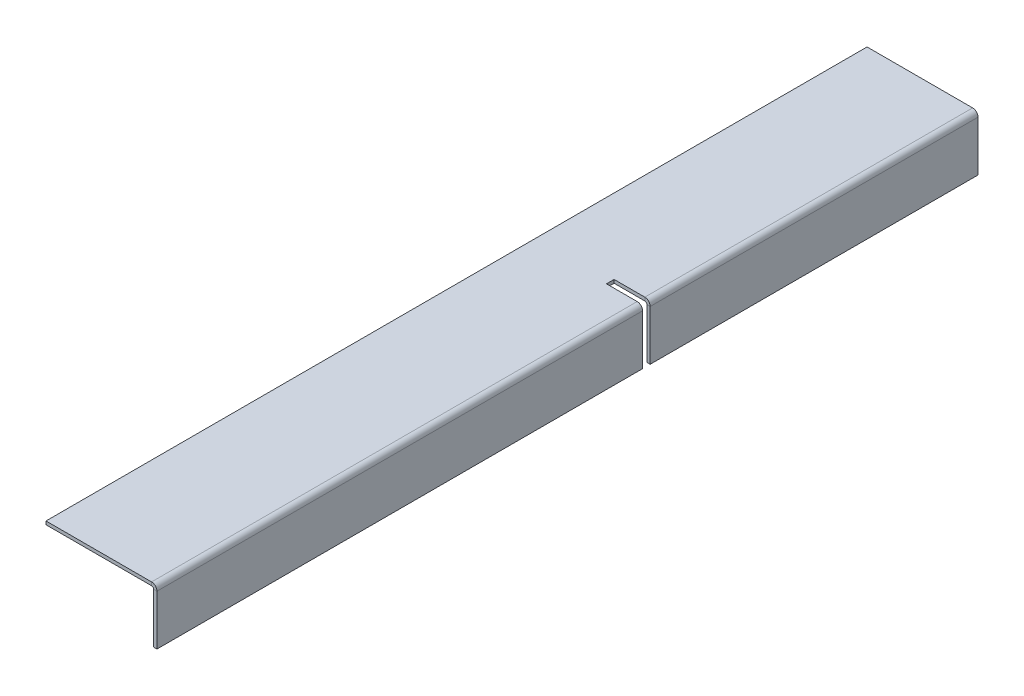
from build123d import *

# Parameters (mm, degrees)
BASE_FLANGE1_DEPTH = 296
SKETCH2_W          = 2.75
SKETCH2_H          = 20.5
CUT_EXTRUDE1_DEPTH = 13


# Sheet-metal steps are written as plain solids
with BuildPart() as part:
    # Sketch1 → Base-Flange1 (new body)
    with BuildSketch(Plane.XY):
        with BuildLine():
            Line((0, 0), (0, 18.0634))
            ThreePointArc((0, 18.0634), (-0.567217008, 19.432782992), (-1.9366, 20))
            Line((-1.9366, 20), (-40, 20))
            Line((-40, 20), (-40, 18.8))
            Line((-40, 18.8), (-1.9366, 18.8))
            ThreePointArc((-1.9366, 18.8), (-1.415745145, 18.584254855), (-1.2, 18.0634))
            Line((-1.2, 18.0634), (-1.2, 0))
            Line((-1.2, 0), (0, 0))
        make_face()
    extrude(amount=BASE_FLANGE1_DEPTH)

    # Sketch2 → Cut-Extrude1 (cut)
    with BuildSketch(Plane(origin=(0, 0, 0), x_dir=(0, 0, -1), z_dir=(1, 0, 0))):
        with Locations((-119.558385949, 9.989549108)):
            Rectangle(SKETCH2_W, SKETCH2_H)
    extrude(amount=-CUT_EXTRUDE1_DEPTH, mode=Mode.SUBTRACT)


solid = part.part
